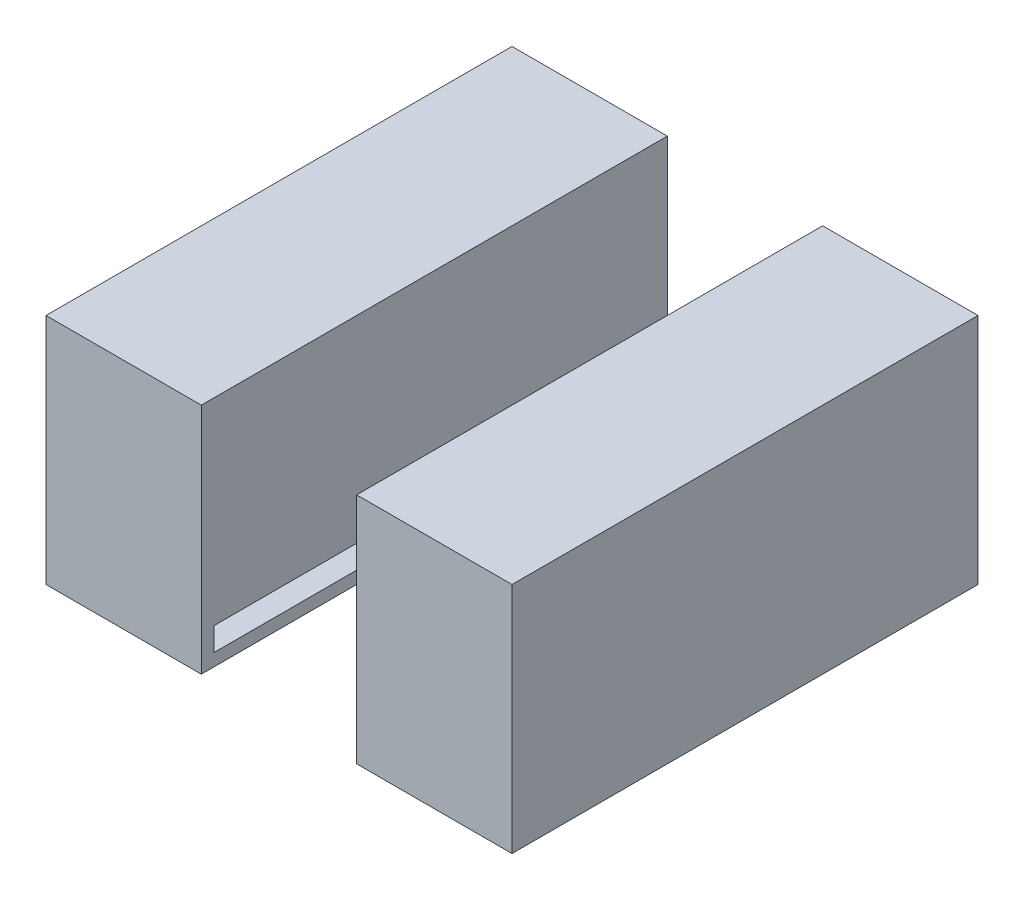
from build123d import *

# Parameters (mm, degrees)
SKETCH1_W           = 60
SKETCH1_H           = 30
BOSS_EXTRUDE1_DEPTH = 30
SKETCH2_W           = 20
SKETCH2_H           = 30
CUT_EXTRUDE1_DEPTH  = 30
SKETCH3_W           = 16.8
SKETCH3_H           = 26.8
CUT_EXTRUDE2_DEPTH  = 28.4
SKETCH4_W           = 1.6
SKETCH4_H           = 23.8
BOSS_EXTRUDE2_DEPTH = 28.4
SKETCH5_W           = 1.6
SKETCH5_H           = 3
CUT_EXTRUDE3_DEPTH  = 28.4


with BuildPart() as part:
    # Sketch1 → Boss-Extrude1 (new, symmetric)
    with BuildSketch(Plane.XY):
        Rectangle(SKETCH1_W, SKETCH1_H)
    extrude(amount=BOSS_EXTRUDE1_DEPTH, both=True)

    # Sketch2 → Cut-Extrude1 (cut, symmetric)
    with BuildSketch(Plane.XY):
        Rectangle(SKETCH2_W, SKETCH2_H)
    extrude(amount=CUT_EXTRUDE1_DEPTH, both=True, mode=Mode.SUBTRACT)


with BuildPart() as cut_extrude1_piece_1:
    # of the separate pieces the step leaves, piece 1, a body of its own (cut_extrude1_pieces)
    add(part.part.solids().sort_by_distance((-30, -15, 30))[0])


with BuildPart() as cut_extrude1_piece_2:
    # of the separate pieces the step leaves, piece 2, a body of its own (cut_extrude1_pieces)
    add(part.part.solids().sort_by_distance((10, -15, -30))[0])


with BuildPart() as cut_extrude2_tool:
    # Sketch3 → Cut-Extrude2 (new, symmetric)
    with BuildSketch(Plane.XY):
        with Locations((-20, 0)):
            Rectangle(SKETCH3_W, SKETCH3_H)
        with Locations((20, 0)):
            Rectangle(SKETCH3_W, SKETCH3_H)
    extrude(amount=CUT_EXTRUDE2_DEPTH, both=True)


with BuildPart() as cut_extrude1_piece_1_1:
    add(cut_extrude1_piece_1.part)

    # Cut-Extrude2: cut by cut_extrude2_tool
    add(cut_extrude2_tool.part, mode=Mode.SUBTRACT)



with BuildPart() as cut_extrude1_piece_2_1:
    add(cut_extrude1_piece_2.part)

    # Cut-Extrude2: cut by cut_extrude2_tool
    add(cut_extrude2_tool.part, mode=Mode.SUBTRACT)


with BuildPart() as cut_extrude1_piece_1_2:
    add(cut_extrude1_piece_1_1.part)

    add(cut_extrude1_piece_2_1.part)  # Boss-Extrude2 merges Cut-Extrude1 piece 2
    # Sketch4 → Boss-Extrude2 (add, symmetric)
    with BuildSketch(Plane.XY):
        with Locations((-15.4, -1.5)):
            Rectangle(SKETCH4_W, SKETCH4_H)
        with Locations((-20, 1.5)):
            Rectangle(SKETCH4_W, SKETCH4_H)
        with Locations((-24.6, -1.5)):
            Rectangle(SKETCH4_W, SKETCH4_H)
        with Locations((15.4, -1.5)):
            Rectangle(SKETCH4_W, SKETCH4_H)
        with Locations((20, 1.5)):
            Rectangle(SKETCH4_W, SKETCH4_H)
        with Locations((24.6, -1.5)):
            Rectangle(SKETCH4_W, SKETCH4_H)
    extrude(amount=BOSS_EXTRUDE2_DEPTH, both=True)

    # Sketch5 → Cut-Extrude3 (cut, symmetric)
    with BuildSketch(Plane.XY):
        with Locations((-10.8, -11.9)):
            Rectangle(SKETCH5_W, SKETCH5_H)
        with Locations((10.8, -11.9)):
            Rectangle(SKETCH5_W, SKETCH5_H)
    extrude(amount=CUT_EXTRUDE3_DEPTH, both=True, mode=Mode.SUBTRACT)


solid = cut_extrude1_piece_1_2.part
